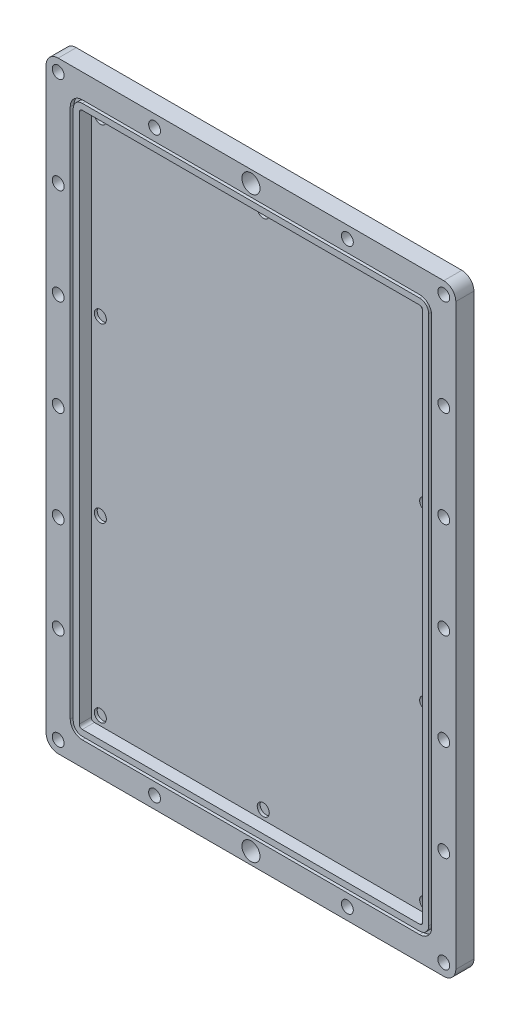
from build123d import *

# Parameters (mm, degrees)
SKETCH1_W           = 215.9
SKETCH1_H           = 317.5
BOSS_EXTRUDE1_DEPTH = 9.525
SKETCH4_R           = 3.1242
CUT_EXTRUDE1_DEPTH  = 385.070026981
CUT_EXTRUDE2_DEPTH  = 2.032
CUT_EXTRUDE3_DEPTH  = 6.35
SKETCH7_R           = 3.175
CUT_EXTRUDE4_DEPTH  = 1.524
SKETCH8_R           = 4.7625
CUT_EXTRUDE5_DEPTH  = 385.070026981
FILLET1_R           = 6.35


with BuildPart() as part:
    # Sketch1 → Boss-Extrude1 (new body)
    with BuildSketch(Plane.XY):
        with Locations((107.95, 158.75)):
            Rectangle(SKETCH1_W, SKETCH1_H)
    extrude(amount=BOSS_EXTRUDE1_DEPTH)

    # Sketch4 → Cut-Extrude1 (cut, through all)
    with BuildSketch(Plane.XY.offset(9.525)):
        with Locations((6.35, 6.35)):
            Circle(SKETCH4_R)
        with Locations((6.35, 311.15)):
            Circle(SKETCH4_R)
        with Locations((209.55, 311.15)):
            Circle(SKETCH4_R)
        with Locations((209.55, 6.35)):
            Circle(SKETCH4_R)
        with Locations((57.15, 311.15)):
            Circle(SKETCH4_R)
        with Locations((57.15, 6.35)):
            Circle(SKETCH4_R)
        with Locations((107.95, 311.15)):
            Circle(SKETCH4_R)
        with Locations((107.95, 6.35)):
            Circle(SKETCH4_R)
        with Locations((158.75, 311.15)):
            Circle(SKETCH4_R)
        with Locations((158.75, 6.35)):
            Circle(SKETCH4_R)
        with Locations((6.35, 260.35)):
            Circle(SKETCH4_R)
        with Locations((209.55, 260.35)):
            Circle(SKETCH4_R)
        with Locations((6.35, 209.55)):
            Circle(SKETCH4_R)
        with Locations((209.55, 209.55)):
            Circle(SKETCH4_R)
        with Locations((6.35, 158.75)):
            Circle(SKETCH4_R)
        with Locations((209.55, 158.75)):
            Circle(SKETCH4_R)
        with Locations((6.35, 107.95)):
            Circle(SKETCH4_R)
        with Locations((209.55, 107.95)):
            Circle(SKETCH4_R)
        with Locations((6.35, 57.15)):
            Circle(SKETCH4_R)
        with Locations((209.55, 57.15)):
            Circle(SKETCH4_R)
    extrude(amount=-CUT_EXTRUDE1_DEPTH, mode=Mode.SUBTRACT)

    # Sketch5 → Cut-Extrude2 (cut)
    with BuildSketch(Plane.XY.offset(9.525)):
        with BuildLine():
            Line((196.85, 304.8), (19.05, 304.8))
            ThreePointArc((19.05, 304.8), (14.559871939, 302.940128061), (12.7, 298.45))
            Line((12.7, 298.45), (12.7, 19.05))
            ThreePointArc((12.7, 19.05), (14.559871939, 14.559871939), (19.05, 12.7))
            Line((19.05, 12.7), (196.85, 12.7))
            ThreePointArc((196.85, 12.7), (201.340128061, 14.559871939), (203.2, 19.05))
            Line((203.2, 19.05), (203.2, 298.45))
            ThreePointArc((203.2, 298.45), (201.340128061, 302.940128061), (196.85, 304.8))
        make_face()
        with BuildLine():
            Line((196.85, 14.2875), (19.05, 14.2875))
            ThreePointArc((19.05, 14.2875), (15.682403955, 15.682403955), (14.2875, 19.05))
            Line((14.2875, 19.05), (14.2875, 298.45))
            ThreePointArc((14.2875, 298.45), (15.682403955, 301.817596045), (19.05, 303.2125))
            Line((19.05, 303.2125), (196.85, 303.2125))
            ThreePointArc((196.85, 303.2125), (200.217596045, 301.817596045), (201.6125, 298.45))
            Line((201.6125, 298.45), (201.6125, 19.05))
            ThreePointArc((201.6125, 19.05), (200.217596045, 15.682403955), (196.85, 14.2875))
        make_face(mode=Mode.SUBTRACT)
    extrude(amount=-CUT_EXTRUDE2_DEPTH, mode=Mode.SUBTRACT)

    # Sketch6 → Cut-Extrude3 (cut)
    with BuildSketch(Plane.XY.offset(9.525)):
        with BuildLine():
            Line((198.4375, 19.05), (198.4375, 298.45))
            ThreePointArc((198.4375, 298.45), (197.972532015, 299.572532015), (196.85, 300.0375))
            Line((196.85, 300.0375), (19.05, 300.0375))
            ThreePointArc((19.05, 300.0375), (17.927467985, 299.572532015), (17.4625, 298.45))
            Line((17.4625, 298.45), (17.4625, 19.05))
            ThreePointArc((17.4625, 19.05), (17.927467985, 17.927467985), (19.05, 17.4625))
            Line((19.05, 17.4625), (196.85, 17.4625))
            ThreePointArc((196.85, 17.4625), (197.972532015, 17.927467985), (198.4375, 19.05))
        make_face()
    extrude(amount=-CUT_EXTRUDE3_DEPTH, mode=Mode.SUBTRACT)

    # Sketch7 → Cut-Extrude4 (cut)
    with BuildSketch(Plane.XY.offset(3.175)):
        with Locations((22.225, 295.275)):
            Circle(SKETCH7_R)
        with Locations((193.675, 295.275)):
            Circle(SKETCH7_R)
        with Locations((22.225, 22.225)):
            Circle(SKETCH7_R)
        with Locations((193.675, 22.225)):
            Circle(SKETCH7_R)
        with Locations((108.077, 22.225)):
            Circle(SKETCH7_R)
        with Locations((108.077, 295.275)):
            Circle(SKETCH7_R)
        with Locations((22.225, 204.343)):
            Circle(SKETCH7_R)
        with Locations((193.675, 204.343)):
            Circle(SKETCH7_R)
        with Locations((22.225, 113.411)):
            Circle(SKETCH7_R)
        with Locations((193.675, 113.411)):
            Circle(SKETCH7_R)
    extrude(amount=-CUT_EXTRUDE4_DEPTH, mode=Mode.SUBTRACT)

    # Sketch8 → Cut-Extrude5 (cut, through all)
    with BuildSketch(Plane.XY.offset(9.525)):
        with Locations((107.95, 311.15)):
            Circle(SKETCH8_R)
        with Locations((107.95, 6.35)):
            Circle(SKETCH8_R)
    extrude(amount=-CUT_EXTRUDE5_DEPTH, mode=Mode.SUBTRACT)

    # Fillet1
    fillet1_edges = [part.edges().sort_by_distance(p)[0] for p in [
        (215.9, 0, 4.7625),
        (0, 0, 4.7625),
        (215.9, 317.5, 4.7625),
        (0, 317.5, 4.7625),
    ]]
    fillet(fillet1_edges, radius=FILLET1_R)


solid = part.part
